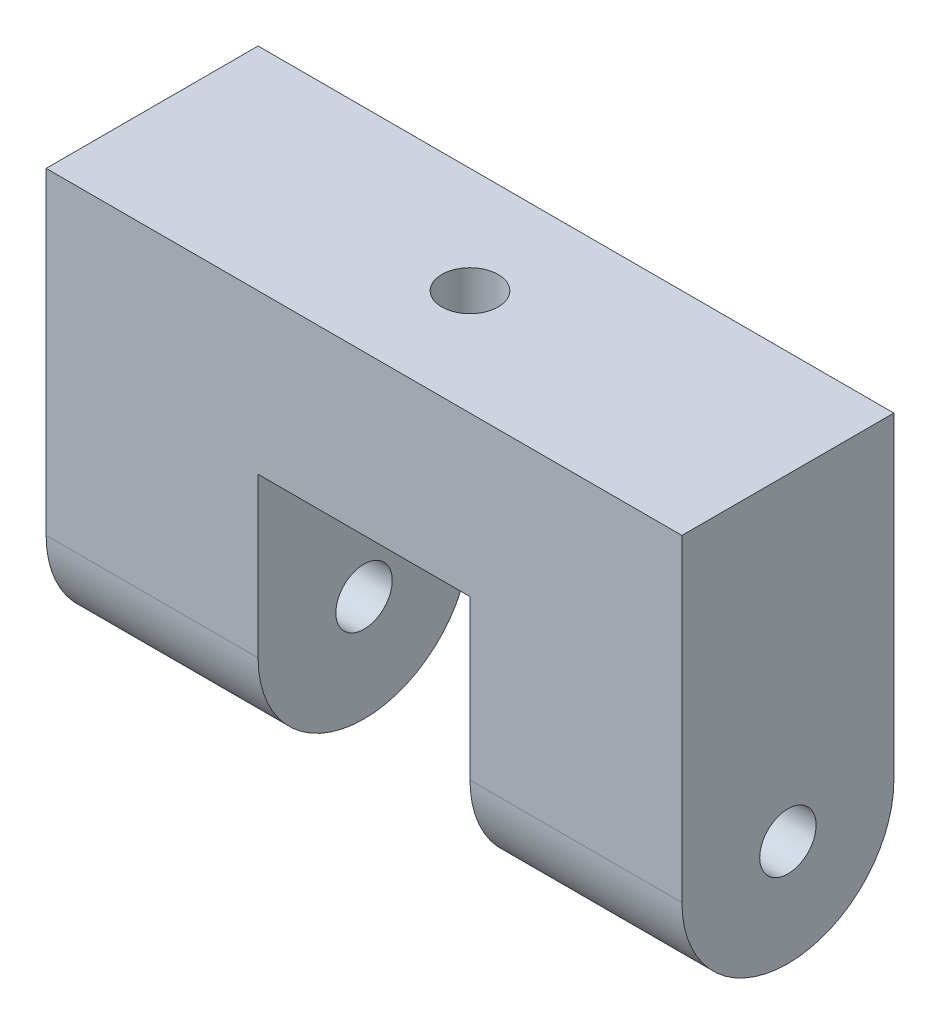
from build123d import *

# Parameters (mm, degrees)
SKETCH1_W           = 76.2
SKETCH1_H           = 25.4
BOSS_EXTRUDE1_DEPTH = 19.05
SKETCH1_7_W         = 25.4
SKETCH1_7_H         = 25.4
BOSS_EXTRUDE3_DEPTH = 31.75
CUT_EXTRUDE4_DEPTH  = 84.521209881
FILLET1_R           = 12.7
SKETCH3_R           = 3.3782
CUT_EXTRUDE5_DEPTH  = 65.757547823
CUT_EXTRUDE6_DEPTH  = 4.445


with BuildPart() as part:
    # Sketch1 → Boss-Extrude1 (new body)
    with BuildSketch(Plane(origin=(0, 0, 0), x_dir=(1, 0, 0), z_dir=(0, 1, 0))):
        Rectangle(SKETCH1_W, SKETCH1_H)
    extrude(amount=BOSS_EXTRUDE1_DEPTH)

    # Sketch1<7> → Boss-Extrude3 (add)
    with BuildSketch(Plane(origin=(0, 0, 0), x_dir=(1, 0, 0), z_dir=(0, 1, 0))):
        with Locations((-25.4, 0)):
            Rectangle(SKETCH1_7_W, SKETCH1_7_H)
        with Locations((25.4, 0)):
            Rectangle(SKETCH1_7_W, SKETCH1_7_H)
    extrude(amount=-BOSS_EXTRUDE3_DEPTH)

    # Sketch2 → Cut-Extrude4 (cut, through all)
    with BuildSketch(Plane.ZY.offset(38.1)):
        with BuildLine():
            ThreePointArc((3.3782, -19.05), (2.388748128, -16.661251872), (0, -15.6718))
            Line((0, -15.6718), (0, -22.4282))
            ThreePointArc((0, -22.4282), (2.388748128, -21.438748128), (3.3782, -19.05))
        make_face()
        with BuildLine():
            Line((0, -22.4282), (0, -15.6718))
            ThreePointArc((0, -15.6718), (-3.3782, -19.05), (0, -22.4282))
        make_face()
    extrude(amount=-CUT_EXTRUDE4_DEPTH, mode=Mode.SUBTRACT)

    # Fillet1
    fillet1_edges = [part.edges().sort_by_distance(p)[0] for p in [
        (-25.4, -31.75, 12.7),
        (25.4, -31.75, 12.7),
        (25.4, -31.75, -12.7),
        (-25.4, -31.75, -12.7),
    ]]
    fillet(fillet1_edges, radius=FILLET1_R - 0.0001)  # a hair under: the kernel refuses the full size

    # Sketch3 → Cut-Extrude5 (cut, through all)
    with BuildSketch(Plane(origin=(0, 19.05, 0), x_dir=(1, 0, 0), z_dir=(0, 1, 0))):
        with Locations(Location((0, 0, 0), (0, 0, 270))):
            Circle(SKETCH3_R)
    extrude(amount=-CUT_EXTRUDE5_DEPTH, mode=Mode.SUBTRACT)

    # Sketch4 → Cut-Extrude6 (cut, symmetric)
    with BuildSketch(Plane(origin=(0, 9.525, 0), x_dir=(-1, 0, 0), z_dir=(0, -1, 0))):
        Polygon((6.599113577, 12.7), (-6.599113577, 12.7), (-6.599113577, 0), (-3.299556788, 5.715), (3.299556788, 5.715), (6.599113577, 0), align=None)
        Polygon((-6.599113577, 0), (-3.299556788, -5.715), (3.299556788, -5.715), (6.599113577, 0), (3.299556788, 5.715), (-3.299556788, 5.715), align=None)
    extrude(amount=CUT_EXTRUDE6_DEPTH, both=True, mode=Mode.SUBTRACT)


solid = part.part
